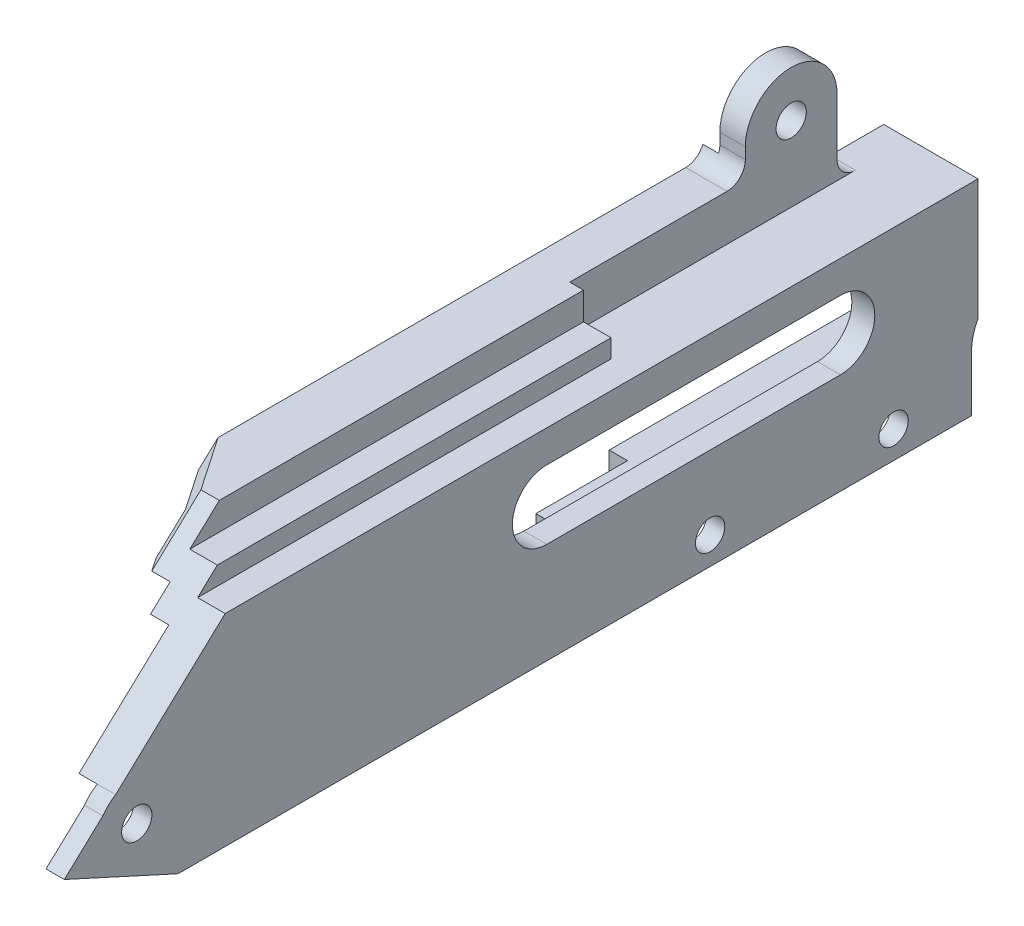
from build123d import *
from build123d.topology import SkipClean

# Parameters (mm, degrees)
SKETCH_1_W                       = 33.2
SKETCH_1_H                       = 22
SKETCH_1_R                       = 1.6
EXTRUDE_1_DEPTH                  = 7
SKETCH_2_W                       = 33.2
SKETCH_2_H                       = 10.5
EXTRUDE_2_DEPTH                  = 2
EXTRUDE_3_DEPTH                  = 60
SKETCH_4_W                       = 2
SKETCH_4_H                       = 10.5
EXTRUDE_4_DEPTH                  = 38.5
SKETCH_5_W                       = 4
SKETCH_5_H                       = 10.5
EXTRUDE_5_DEPTH                  = 2
SKETCH_6_W                       = 4
SKETCH_6_H                       = 10.5
EXTRUDE_6_DEPTH                  = 19.5
SKETCH_7_W                       = 6
SKETCH_7_H                       = 93.2
EXTRUDE_7_DEPTH                  = 2
SKETCH_8_W                       = 93.2
SKETCH_8_H                       = 5
EXTRUDE_8_DEPTH                  = 3
SKETCH_10_W                      = 93.2
SKETCH_10_H                      = 2
EXTRUDE_9_DEPTH                  = 5.5
SKETCH_12_W                      = 18
SKETCH_12_H                      = 2
CUT_EXTRUDE_1_DEPTH              = 5.5
SKETCH_13_W                      = 40
SKETCH_13_H                      = 5
EXTRUDE_10_DEPTH                 = 3.5
CUT_EXTRUDE_2_REACH              = 70.879
SKETCH_15_W                      = 15.5
SKETCH_15_H                      = 5
SKETCH_16_W                      = 3.5
SKETCH_16_H                      = 2.5
EXTRUDE_12_DEPTH                 = 2
CUT_EXTRUDE_3_REACH              = 71.313
CHAMFER_1_SIZE                   = 3.5
SKETCH_18_R                      = 1.65
EXTRUDE_13_DEPTH                 = 2
FILLET_1_R                       = 2
SKETCH_19_W                      = 4.5
SKETCH_19_H                      = 21.5
CUT_EXTRUDE_4_DEPTH              = 5
CHAMFER_2_SIZE                   = 3
CUT_EXTRUDE_5_REACH              = 74.561
SKETCH_20_R                      = 1.65
EXTRUDE_14_REACH                 = 73.895
SKETCH_21_R                      = 4.5
SKETCH_21_R_2                    = 1.65
EXTRUDE_15_DEPTH                 = 6
EXTRUDE_16_DEPTH                 = 4
CUT_EXTRUDE_6_REACH              = 83.84
SKETCH_24_R                      = 1.65
CUT_EXTRUDE_7_REACH              = 84.171
SKETCH_26_W                      = 2
SKETCH_26_H                      = 10.5
CUT_EXTRUDE_8_DEPTH              = 5
SKETCH_27_W                      = 2
SKETCH_27_H                      = 2
EXTRUDE_17_DEPTH                 = 10
CUT_EXTRUDE_9_DEPTH              = 2
CUT_EXTRUDE_10_REACH             = 84.426
SKETCH_29_R                      = 5.5
SKETCH_30_W                      = 63
SKETCH_30_H                      = 2
EXTRUDE_18_DEPTH                 = 1
SKETCH_32_R                      = 1.65
EXTRUDE_19_DEPTH                 = 0.775
EXTRUDE_20_DEPTH                 = 5.5
SKETCH_35_W                      = 5
SKETCH_35_H                      = 10
CUT_EXTRUDE_12_DEPTH             = 1.225
SKETCH_36_W                      = 4
SKETCH_36_H                      = 10
EXTRUDE_21_DEPTH                 = 5
CUT_EXTRUDE_13_REACH             = 84.197
SKETCH_37_W                      = 4.75
SKETCH_37_H                      = 3
CUT_EXTRUDE_13_DIRECTION_2_REACH = 84.197
CUT_EXTRUDE_14_REACH             = 84.197
SKETCH_38_W                      = 14.6
SKETCH_38_H                      = 11
CUT_EXTRUDE_14_DIRECTION_2_DEPTH = 1
SKETCH_39_W                      = 1.5
SKETCH_39_H                      = 20
EXTRUDE_22_DEPTH                 = 5.8
EXTRUDE_22_DIRECTION_2_REACH     = 116.063
SKETCH_40_W                      = 1.5
SKETCH_40_H                      = 10
EXTRUDE_23_DEPTH                 = 5
CUT_EXTRUDE_15_REACH             = 84.085
SKETCH_41_W                      = 1
SKETCH_41_H                      = 7
CHAMFER_3_SIZE                   = 1
SKETCH_42_W                      = 2.775
SKETCH_42_H                      = 5
EXTRUDE_24_DEPTH                 = 10.8
CUT_EXTRUDE_16_REACH             = 84.085
SKETCH_43_W                      = 0.6
SKETCH_43_H                      = 2
SKETCH_44_W                      = 9.8
SKETCH_44_H                      = 2
EXTRUDE_25_DEPTH                 = 2
SKETCH_45_W                      = 0.8
SKETCH_45_H                      = 6.1
CUT_EXTRUDE_17_DEPTH             = 0.775
CUT_EXTRUDE_18_REACH             = 84.426
SKETCH_46_R                      = 2.05
CUT_EXTRUDE_19_DEPTH             = 1
SKETCH_48_R                      = 2.05
CUT_EXTRUDE_20_DEPTH             = 5
CUT_EXTRUDE_21_REACH             = 113.959
SKETCH_50_W                      = 0.5
SKETCH_50_H                      = 17.5
CUT_EXTRUDE_22_DEPTH             = 3
EXTRUDE_26_DEPTH                 = 14.5
EXTRUDE_27_DEPTH                 = 0.5
SKETCH_54_W                      = 28.68337521
SKETCH_54_H                      = 12.5
SKETCH_54_W_2                    = 11.341687605
CUT_EXTRUDE_23_DEPTH             = 3
EXTRUDE_28_REACH                 = 83.879
FILLET_2_R                       = 0.8
EXTRUDE_START                    = -3.5
SKETCH_56_R                      = 4
SKETCH_56_R_2                    = 2.05
EXTRUDE_29_DEPTH                 = 3.5
FILLET_3_R                       = 0.8
CUT_EXTRUDE_24_REACH             = 83.879
SKETCH_57_R                      = 2.05
SKETCH_58_W                      = 15.2
SKETCH_58_H                      = 8.5
CUT_EXTRUDE_25_DEPTH             = 3.5
FILLET_4_R                       = 0.8
EXTRUDE_START_2                  = 0.5
SKETCH_31_W                      = 76.7
SKETCH_31_H                      = 10.5
EXTRUDE_30_DEPTH                 = 0.5
CUT_EXTRUDE_26_REACH             = 83.939
SKETCH_59_W                      = 2.6
SKETCH_59_H                      = 10
CUT_EXTRUDE_27_REACH             = 83.939
EXTRUDE_31_DEPTH                 = 1.5
SKETCH_62_W                      = 2.775
SKETCH_62_H                      = 2
EXTRUDE_32_DEPTH                 = 1.5
EXTRUDE_33_DEPTH                 = 1.5
SKETCH_64_W                      = 4.275
SKETCH_64_H                      = 5
EXTRUDE_34_DEPTH                 = 5
CHAMFER_4_SIZE                   = 2
EXTRUDE_START_3                  = 1.5
SKETCH_65_R                      = 2.05
EXTRUDE_35_DEPTH                 = 1.5
CUT_EXTRUDE_28_DEPTH             = 1
SKETCH_67_W                      = 1.5
SKETCH_67_H                      = 1.5
EXTRUDE_36_DEPTH                 = 1.5
CUT_EXTRUDE_29_REACH             = 76.844
EXTRUDE_37_REACH                 = 74.163
CUT_EXTRUDE_30_DEPTH             = 10
EXTRUDE_38_DEPTH                 = 0.5
CUT_EXTRUDE_START                = -36.378813151
CUT_EXTRUDE_31_OUTLINE_W         = 3
CUT_EXTRUDE_31_OUTLINE_H         = 6
CUT_EXTRUDE_31_DEPTH             = 0.35355339
FILLET_5_R                       = 1
CUT_EXTRUDE_32_DEPTH             = 101
CUT_EXTRUDE_34_REACH             = 83.84
CUT_EXTRUDE_34_DIRECTION_2_REACH = 83.84
EXTRUDE_START_4                  = 1.225
SKETCH_76_R                      = 1.6
EXTRUDE_40_DEPTH                 = 1.225
CUT_EXTRUDE_35_DEPTH             = 4
CUT_EXTRUDE_36_REACH             = 79.818
FILLET_7_R                       = 1
FILLET_8_R                       = 2.5


# Read off the part's stored shape, not the designer's step: 切除-拉伸31
# Some blends are built 0.0001 mm under size
with BuildPart() as part:
    # 草图1 → 凸台-拉伸1 (new body)
    with BuildSketch(Plane(origin=(0, 0, 0), x_dir=(0, 0, -1), z_dir=(1, 0, 0))):
        with Locations((12.6, -4.5)):
            Rectangle(SKETCH_1_W, SKETCH_1_H)
        Circle(SKETCH_1_R, mode=Mode.SUBTRACT)
        with Locations((20, 0)):
            Circle(SKETCH_1_R, mode=Mode.SUBTRACT)
    extrude(amount=EXTRUDE_1_DEPTH)

    # 草图2 → 凸台-拉伸2 (add)
    with BuildSketch(Plane(origin=(7, 0, 0), x_dir=(0, 0, -1), z_dir=(1, 0, 0))):
        with Locations((12.6, 11.75)):
            Rectangle(SKETCH_2_W, SKETCH_2_H)
    extrude(amount=-EXTRUDE_2_DEPTH)

    # 草图3 → 凸台-拉伸3 (add)
    with BuildSketch(Plane.XY.offset(4)):
        Polygon((7, -15.5), (1, -15.5), (1, 4.5), (3, 4.5), (3, 6.5), (7, 6.5), align=None)
    extrude(amount=EXTRUDE_3_DEPTH)

    # 草图4 → 凸台-拉伸4 (add)
    with BuildSketch(Plane.XY.offset(4)):
        with Locations((6, 11.75)):
            Rectangle(SKETCH_4_W, SKETCH_4_H)
    extrude(amount=EXTRUDE_4_DEPTH)

    # 草图5 → 凸台-拉伸5 (add)
    with BuildSketch(Plane.XY.offset(42.5)):
        with Locations((5, 11.75)):
            Rectangle(SKETCH_5_W, SKETCH_5_H)
    extrude(amount=EXTRUDE_5_DEPTH)

    # 草图6 → 凸台-拉伸6 (add)
    with BuildSketch(Plane.XY.offset(44.5)):
        with Locations((5, 11.75)):
            Rectangle(SKETCH_6_W, SKETCH_6_H)
    extrude(amount=EXTRUDE_6_DEPTH)

    # 草图7 → 凸台-拉伸7 (add)
    with BuildSketch(Plane(origin=(0, 17, 0), x_dir=(1, 0, 0), z_dir=(0, 1, 0))):
        with Locations((4, -17.4)):
            Rectangle(SKETCH_7_W, SKETCH_7_H)
    extrude(amount=EXTRUDE_7_DEPTH)

    # 草图8 → 凸台-拉伸8 (add)
    with BuildSketch(Plane.ZY.offset(-1)):
        with Locations((17.4, 21.5)):
            Rectangle(SKETCH_8_W, SKETCH_8_H)
    extrude(amount=-EXTRUDE_8_DEPTH)

    # 草图10 → 凸台-拉伸9 (add)
    with BuildSketch(Plane.ZY.offset(-1)):
        with Locations((17.4, 23)):
            Rectangle(SKETCH_10_W, SKETCH_10_H)
    extrude(amount=EXTRUDE_9_DEPTH)

    # 草图12 → 切除-拉伸1 (cut)
    with BuildSketch(Plane.ZY.offset(4.5)):
        with Locations((-20.2, 23)):
            Rectangle(SKETCH_12_W, SKETCH_12_H)
    extrude(amount=-CUT_EXTRUDE_1_DEPTH, mode=Mode.SUBTRACT)

    # 草图13 → 凸台-拉伸10 (add)
    with BuildSketch(Plane.ZY.offset(-1)):
        with Locations((-9.2, 19.5)):
            Rectangle(SKETCH_13_W, SKETCH_13_H)
    extrude(amount=EXTRUDE_10_DEPTH)

    # 草图15 → 切除-拉伸2 (cut, up to next)
    with BuildSketch(Plane(origin=(4, 0, 0), x_dir=(0, 0, -1), z_dir=(1, 0, 0)), mode=Mode.PRIVATE) as cut_extrude_2_sk1:
        with Locations((21.45, 21.5)):
            Rectangle(SKETCH_15_W, SKETCH_15_H)
    cut_extrude_2_tool1 = extrude(cut_extrude_2_sk1.sketch, amount=-CUT_EXTRUDE_2_REACH, mode=Mode.PRIVATE) & part.part
    add(cut_extrude_2_tool1.solids().sort_by_distance((4, 21.5, -21.45))[0], mode=Mode.SUBTRACT)

    # 草图16 → 凸台-拉伸12 (add)
    with BuildSketch(Plane(origin=(0, 22, 0), x_dir=(1, 0, 0), z_dir=(0, 1, 0))):
        with Locations((-0.75, 12.45)):
            Rectangle(SKETCH_16_W, SKETCH_16_H)
    extrude(amount=EXTRUDE_12_DEPTH)

    # 草图17 → 切除-拉伸3 (cut, up to next)
    with BuildSketch(Plane(origin=(7, 0, 0), x_dir=(0, 0, -1), z_dir=(1, 0, 0)), mode=Mode.PRIVATE) as cut_extrude_3_sk1:
        Polygon((-47.5, 24), (-64, 8.613501079), (-64, 24), align=None)
    cut_extrude_3_tool1 = extrude(cut_extrude_3_sk1.sketch, amount=-CUT_EXTRUDE_3_REACH, mode=Mode.PRIVATE) & part.part
    add(cut_extrude_3_tool1.solids().sort_by_distance((7, 18.871167, 58.5))[0], mode=Mode.SUBTRACT)

    # 倒角1
    # the kernel refuses this chamfer: 3.5 mm, written as the material it takes off along each edge
    with BuildSketch(Plane(origin=(-4.5, 15.861407469, 56.227571974), x_dir=(0.9996219169112969, 0.020109211138415985, 0.018752142756900524), z_dir=(0, 0.6819983600625026, -0.7313537016191667))) as chamfer_1_piece_1:
        Polygon((CHAMFER_1_SIZE * 0.999621916911, CHAMFER_1_SIZE * 0.0274958766106), (-CHAMFER_1_SIZE * 0.0274958766106, CHAMFER_1_SIZE * 0.999621916911), (0, 0), align=None)
    extrude(amount=20.934339287, mode=Mode.SUBTRACT)

    # 草图18 → 凸台-拉伸13 (add)
    with BuildSketch(Plane.ZY.offset(2.5)):
        with BuildLine():
            Line((-11.337, 27.2), (-11.337, 24))
            Line((-11.337, 24), (-13.7, 24))
            Line((-13.7, 24), (-13.7, 19))
            Line((-13.7, 19), (-21.337, 19))
            Line((-21.337, 19), (-21.337, 27.2))
            ThreePointArc((-21.337, 27.2), (-16.337, 32.2), (-11.337, 27.2))
        make_face()
        with Locations((-16.337, 27.2)):
            Circle(SKETCH_18_R, mode=Mode.SUBTRACT)
    extrude(amount=-EXTRUDE_13_DEPTH)

    # 圆角1
    fillet_1_edges = [part.edges().sort_by_distance(p)[0] for p in [
        (-1.5, 24, -11.337),
        (-1.5, 19, -21.337),
    ]]
    fillet(fillet_1_edges, radius=FILLET_1_R)

    # 草图19 → 切除-拉伸4 (cut)
    with BuildSketch(Plane(origin=(0, 24, 0), x_dir=(1, 0, 0), z_dir=(0, 1, 0))):
        with Locations((1.75, 2.95)):
            Rectangle(SKETCH_19_W, SKETCH_19_H)
    extrude(amount=-CUT_EXTRUDE_4_DEPTH, mode=Mode.SUBTRACT)

    # 倒角2
    chamfer_2_edges = [part.edges().sort_by_distance(p)[0] for p in [
        (4, 24, 27.65),
        (1, 22, 30.22236871),
    ]]
    chamfer(chamfer_2_edges, length=CHAMFER_2_SIZE)

    # 草图20 → 切除-拉伸5 (cut, up to next)
    with BuildSketch(Plane(origin=(7, 0, 0), x_dir=(0, 0, -1), z_dir=(1, 0, 0)), mode=Mode.PRIVATE) as cut_extrude_5_sk1:
        with Locations((-62.5, 4)):
            Circle(SKETCH_20_R)
    cut_extrude_5_tool1 = extrude(cut_extrude_5_sk1.sketch, amount=-CUT_EXTRUDE_5_REACH, mode=Mode.PRIVATE) & part.part
    add(cut_extrude_5_tool1.solids().sort_by_distance((7, 4, 62.5))[0], mode=Mode.SUBTRACT)

    # 凸台-拉伸14: up to this face of the body (flat: up to its plane)
    extrude_14_end = Plane(part.part.faces().sort_by_distance((7, 1.498387626, 16.627822956))[0])
    # 草图21 → 凸台-拉伸14 (add, up to the picked face)
    with BuildSketch(Plane.ZY.offset(-1), mode=Mode.PRIVATE) as extrude_14_sk1:
        with Locations((62.5, 4)):
            Circle(SKETCH_21_R)
        with Locations(Location((62.5, 4, 0), (0, 0, 180))):
            Circle(SKETCH_21_R_2, mode=Mode.SUBTRACT)
    extrude_14_tool1 = split(extrude(extrude_14_sk1.sketch, amount=-EXTRUDE_14_REACH, mode=Mode.PRIVATE), bisect_by=extrude_14_end, keep=Keep.BOTH, mode=Mode.PRIVATE)
    add(extrude_14_tool1.solids().sort_by(Axis((1, 4, 58.127279), (1, 0, 0)))[0])

    # 草图22 → 凸台-拉伸15 (add)
    with BuildSketch(Plane.ZY.offset(-1)):
        with BuildLine():
            Line((66.198595209, 6.563277878), (75, -1.644164869))
            Line((75, -1.644164869), (75, -15.5))
            Line((75, -15.5), (64, -15.5))
            Line((64, -15.5), (64, -0.242640687))
            ThreePointArc((64, -0.242640687), (66.782111619, 2.616699568), (66.198595209, 6.563277878))
        make_face()
    extrude(amount=-EXTRUDE_15_DEPTH)

    # 草图23 → 凸台-拉伸16 (add)
    with BuildSketch(Plane(origin=(7, 0, 0), x_dir=(0, 0, -1), z_dir=(1, 0, 0))):
        Polygon((-64, 8.613501079), (-64.799032902, 7.868390843), (-64, 8.242640687), align=None)
    extrude(amount=-EXTRUDE_16_DEPTH)

    # 草图24 → 切除-拉伸6 (cut, up to next)
    with BuildSketch(Plane.ZY.offset(-1), mode=Mode.PRIVATE) as cut_extrude_6_sk1:
        with Locations(Location((71, -10.5, 0), (0, 0, 270))):
            Circle(SKETCH_24_R)
    cut_extrude_6_tool1 = extrude(cut_extrude_6_sk1.sketch, amount=-CUT_EXTRUDE_6_REACH, mode=Mode.PRIVATE) & part.part
    add(cut_extrude_6_tool1.solids().sort_by_distance((1, -10.5, 71))[0], mode=Mode.SUBTRACT)

    # 草图25 → 切除-拉伸7 (cut, up to next)
    with BuildSketch(Plane.ZY.offset(-5), mode=Mode.PRIVATE) as cut_extrude_7_sk1:
        with BuildLine():
            Line((17.8, 8), (-14.2, 8))
            ThreePointArc((-14.2, 8), (-17.95, 11.75), (-14.2, 15.5))
            Line((-14.2, 15.5), (17.8, 15.5))
            ThreePointArc((17.8, 15.5), (21.55, 11.75), (17.8, 8))
        make_face()
    cut_extrude_7_tool1 = extrude(cut_extrude_7_sk1.sketch, amount=-CUT_EXTRUDE_7_REACH, mode=Mode.PRIVATE) & part.part
    add(cut_extrude_7_tool1.solids().sort_by_distance((5, 11.75, 1.8))[0], mode=Mode.SUBTRACT)

    # 草图26 → 切除-拉伸8 (cut)
    with BuildSketch(Plane(origin=(0, 0, 42.5), x_dir=(-1, 0, 0), z_dir=(0, 0, -1))):
        with Locations((-4, 11.75)):
            Rectangle(SKETCH_26_W, SKETCH_26_H)
    extrude(amount=-CUT_EXTRUDE_8_DEPTH, mode=Mode.SUBTRACT)

    # 草图27 → 凸台-拉伸17 (add)
    with BuildSketch(Plane.XY.offset(4)):
        with Locations((2, 5.5)):
            Rectangle(SKETCH_27_W, SKETCH_27_H)
    extrude(amount=EXTRUDE_17_DEPTH)

    # 草图28 → 切除-拉伸9 (cut)
    with BuildSketch(Plane.ZY.offset(-1)):
        Polygon((67, 1.494263267), (67, -15.5), (75, -15.5), (75, -1.644164869), (69.155582564, 3.80584256), align=None)
    extrude(amount=-CUT_EXTRUDE_9_DEPTH, mode=Mode.SUBTRACT)

    # 草图29 → 切除-拉伸10 (cut, up to next)
    with BuildSketch(Plane(origin=(7, 0, 0), x_dir=(0, 0, -1), z_dir=(1, 0, 0)), mode=Mode.PRIVATE) as cut_extrude_10_sk1:
        with Locations((34, 3.1)):
            Circle(SKETCH_29_R)
    cut_extrude_10_tool1 = extrude(cut_extrude_10_sk1.sketch, amount=-CUT_EXTRUDE_10_REACH, mode=Mode.PRIVATE) & part.part
    add(cut_extrude_10_tool1.solids().sort_by_distance((7, 3.1, -34))[0], mode=Mode.SUBTRACT)

    # 草图30 → 凸台-拉伸18 (add)
    with BuildSketch(Plane.ZY.offset(-1)):
        with Locations((35.5, -5.5)):
            Rectangle(SKETCH_30_W, SKETCH_30_H)
    extrude(amount=EXTRUDE_18_DEPTH)

    # 草图32 → 凸台-拉伸19 (add)
    with BuildSketch(Plane.ZY.offset(2.5)):
        with BuildLine():
            Line((-11.2, 22), (-11.2, 25.272517354))
            ThreePointArc((-11.2, 25.272517354), (-11.302451602, 25.62986489), (-11.337, 26))
            Line((-11.337, 26), (-11.337, 27.2))
            ThreePointArc((-11.337, 27.2), (-16.337, 32.2), (-21.337, 27.2))
            Line((-21.337, 27.2), (-21.337, 21))
            ThreePointArc((-21.337, 21), (-21.922786438, 19.585786438), (-23.337, 19))
            Line((-23.337, 19), (-29.2, 19))
            Line((-29.2, 19), (-29.2, 17))
            Line((-29.2, 17), (10.8, 17))
            Line((10.8, 17), (10.8, 22))
            Line((10.8, 22), (-11.2, 22))
        make_face()
        with Locations((-16.337, 27.2)):
            Circle(SKETCH_32_R, mode=Mode.SUBTRACT)
    extrude(amount=EXTRUDE_19_DEPTH)

    # 草图34 → 凸台-拉伸20 (add)
    with BuildSketch(Plane.XZ.offset(15.5)):
        Polygon((3, 75), (3, 67), (1, 67), (1, 4), (0, 4), (0, -29.2), (7, -29.2), (7, 75), align=None)
    extrude(amount=EXTRUDE_20_DEPTH)

    # 草图35 → 切除-拉伸12 (cut)
    with BuildSketch(Plane.ZY):
        with Locations((-26.7, -16)):
            Rectangle(SKETCH_35_W, SKETCH_35_H)
    extrude(amount=-CUT_EXTRUDE_12_DEPTH, mode=Mode.SUBTRACT)

    # 草图36 → 凸台-拉伸21 (add)
    with BuildSketch(Plane(origin=(0, 0, -29.2), x_dir=(-1, 0, 0), z_dir=(0, 0, -1))):
        with Locations((-3.225, -16)):
            Rectangle(SKETCH_36_W, SKETCH_36_H)
    extrude(amount=EXTRUDE_21_DEPTH)

    # 草图37 → 切除-拉伸13 (cut, up to next)
    with BuildSketch(Plane(origin=(5.225, 0, 0), x_dir=(0, 0, -1), z_dir=(1, 0, 0)), mode=Mode.PRIVATE) as cut_extrude_13_sk1:
        with Locations((31.225, -14.5)):
            Rectangle(SKETCH_37_W, SKETCH_37_H)
    cut_extrude_13_tool1 = extrude(cut_extrude_13_sk1.sketch, amount=-CUT_EXTRUDE_13_REACH, mode=Mode.PRIVATE) & part.part
    add(cut_extrude_13_tool1.solids().sort_by_distance((5.225, -14.5, -31.225))[0], mode=Mode.SUBTRACT)

    # 草图37 → 切除-拉伸13 direction 2 (cut, up to next)
    with BuildSketch(Plane(origin=(5.225, 0, 0), x_dir=(0, 0, -1), z_dir=(1, 0, 0)), mode=Mode.PRIVATE) as cut_extrude_13_direction_2_sk1:
        with Locations((31.225, -14.5)):
            Rectangle(SKETCH_37_W, SKETCH_37_H)
    cut_extrude_13_direction_2_tool1 = extrude(cut_extrude_13_direction_2_sk1.sketch, amount=CUT_EXTRUDE_13_DIRECTION_2_REACH, mode=Mode.PRIVATE) & part.part
    add(cut_extrude_13_direction_2_tool1.solids().sort_by_distance((5.225, -14.5, -31.225))[0], mode=Mode.SUBTRACT)

    # 草图38 → 切除-拉伸14 (cut, up to next)
    with BuildSketch(Plane(origin=(5.225, 0, 0), x_dir=(0, 0, -1), z_dir=(1, 0, 0)), mode=Mode.PRIVATE) as cut_extrude_14_sk1:
        with Locations((26.9, -8.5)):
            Rectangle(SKETCH_38_W, SKETCH_38_H)
    cut_extrude_14_tool1 = extrude(cut_extrude_14_sk1.sketch, amount=CUT_EXTRUDE_14_REACH, mode=Mode.PRIVATE) & part.part
    add(cut_extrude_14_tool1.solids().sort_by_distance((5.225, -8.5, -26.9))[0], mode=Mode.SUBTRACT)

    # 草图38 → 切除-拉伸14 direction 2 (cut)
    with BuildSketch(Plane(origin=(5.225, 0, 0), x_dir=(0, 0, -1), z_dir=(1, 0, 0))):
        with Locations((26.9, -8.5)):
            Rectangle(SKETCH_38_W, SKETCH_38_H)
    extrude(amount=-CUT_EXTRUDE_14_DIRECTION_2_DEPTH, mode=Mode.SUBTRACT)

    # 草图39 → 凸台-拉伸22 (add)
    with BuildSketch(Plane(origin=(0, 0, -34.2), x_dir=(-1, 0, 0), z_dir=(0, 0, -1))):
        with Locations((-3.475, -11)):
            Rectangle(SKETCH_39_W, SKETCH_39_H)
    extrude(amount=EXTRUDE_22_DEPTH)

    # 草图39 → 凸台-拉伸22 direction 2 (add, up to next)
    with BuildSketch(Plane(origin=(0, 0, -34.2), x_dir=(-1, 0, 0), z_dir=(0, 0, -1)), mode=Mode.PRIVATE) as extrude_22_direction_2_sk1:
        with Locations((-3.475, -11)):
            Rectangle(SKETCH_39_W, SKETCH_39_H)
    extrude_22_direction_2_tool1 = extrude(extrude_22_direction_2_sk1.sketch, amount=-EXTRUDE_22_DIRECTION_2_REACH, mode=Mode.PRIVATE) - part.part
    add(extrude_22_direction_2_tool1.solids().sort_by_distance((3.475, -11, -34.2))[0])

    # 草图40 → 凸台-拉伸23 (add)
    with BuildSketch(Plane(origin=(0, 0, -29.2), x_dir=(-1, 0, 0), z_dir=(0, 0, -1))):
        with Locations((-1.975, -6)):
            Rectangle(SKETCH_40_W, SKETCH_40_H)
    extrude(amount=EXTRUDE_23_DEPTH)

    # 草图41 → 切除-拉伸15 (cut, up to next)
    with BuildSketch(Plane(origin=(4.225, 0, 0), x_dir=(0, 0, -1), z_dir=(1, 0, 0)), mode=Mode.PRIVATE) as cut_extrude_15_sk1:
        with Locations((39.5, -4.5)):
            Rectangle(SKETCH_41_W, SKETCH_41_H)
    cut_extrude_15_tool1 = extrude(cut_extrude_15_sk1.sketch, amount=-CUT_EXTRUDE_15_REACH, mode=Mode.PRIVATE) & part.part
    add(cut_extrude_15_tool1.solids().sort_by_distance((4.225, -4.5, -39.5))[0], mode=Mode.SUBTRACT)

    # 倒角3
    chamfer_3_edges = [part.edges().sort_by_distance(p)[0] for p in [
        (3.475, -8, -39),
    ]]
    chamfer(chamfer_3_edges, length=CHAMFER_3_SIZE - 0.0001)  # a hair under: the kernel refuses the full size

    # 草图42 → 凸台-拉伸24 (add)
    with BuildSketch(Plane(origin=(0, 0, -29.2), x_dir=(-1, 0, 0), z_dir=(0, 0, -1))):
        with Locations((-5.6125, -18.5)):
            Rectangle(SKETCH_42_W, SKETCH_42_H)
    extrude(amount=EXTRUDE_24_DEPTH)

    # 草图43 → 切除-拉伸16 (cut, up to next)
    with BuildSketch(Plane(origin=(4.225, 0, 0), x_dir=(0, 0, -1), z_dir=(1, 0, 0)), mode=Mode.PRIVATE) as cut_extrude_16_sk1:
        with Locations((33.9, -15)):
            Rectangle(SKETCH_43_W, SKETCH_43_H)
    cut_extrude_16_tool1 = extrude(cut_extrude_16_sk1.sketch, amount=CUT_EXTRUDE_16_REACH, mode=Mode.PRIVATE) & part.part
    add(cut_extrude_16_tool1.solids().sort_by_distance((4.225, -15, -33.9))[0], mode=Mode.SUBTRACT)

    # 草图44 → 凸台-拉伸25 (add)
    with BuildSketch(Plane(origin=(4.225, 0, 0), x_dir=(0, 0, -1), z_dir=(1, 0, 0))):
        with Locations((34.1, -2)):
            Rectangle(SKETCH_44_W, SKETCH_44_H)
    extrude(amount=EXTRUDE_25_DEPTH)

    # 草图45 → 切除-拉伸17 (cut)
    with BuildSketch(Plane(origin=(7, 0, 0), x_dir=(0, 0, -1), z_dir=(1, 0, 0))):
        with Locations((28.9, 0.05)):
            Rectangle(SKETCH_45_W, SKETCH_45_H)
    extrude(amount=-CUT_EXTRUDE_17_DEPTH, mode=Mode.SUBTRACT)

    # 草图46 → 切除-拉伸18 (cut, up to next)
    with BuildSketch(Plane(origin=(7, 0, 0), x_dir=(0, 0, -1), z_dir=(1, 0, 0)), mode=Mode.PRIVATE) as cut_extrude_18_sk1:
        with Locations((13.25, -17)):
            Circle(SKETCH_46_R)
    cut_extrude_18_tool1 = extrude(cut_extrude_18_sk1.sketch, amount=-CUT_EXTRUDE_18_REACH, mode=Mode.PRIVATE) & part.part
    add(cut_extrude_18_tool1.solids().sort_by_distance((7, -17, -13.25))[0], mode=Mode.SUBTRACT)

    # 草图47 → 切除-拉伸19 (cut)
    with BuildSketch(Plane.ZY.offset(-1)):
        with BuildLine():
            Line((62.5, -0.5), (67, -0.5))
            Line((67, -0.5), (67, -4.5))
            Line((67, -4.5), (4, -4.5))
            Line((4, -4.5), (4, 6.5))
            Line((4, 6.5), (14, 6.5))
            Line((14, 6.5), (14, 4.5))
            Line((14, 4.5), (58.027864045, 4.5))
            ThreePointArc((58.027864045, 4.5), (59.145898034, 1), (62.5, -0.5))
        make_face()
    extrude(amount=-CUT_EXTRUDE_19_DEPTH, mode=Mode.SUBTRACT)

    # 草图48 → 切除-拉伸20 (cut)
    with BuildSketch(Plane.XZ.offset(21)):
        with Locations(Location((3.5, 58, 0), (0, 0, 270))):
            Circle(SKETCH_48_R)
        with Locations(Location((3.5, 20, 0), (0, 0, 270))):
            Circle(SKETCH_48_R)
        with Locations(Location((3.5, -18, 0), (0, 0, 270))):
            Circle(SKETCH_48_R)
    extrude(amount=-CUT_EXTRUDE_20_DEPTH, mode=Mode.SUBTRACT)

    # 草图50 → 切除-拉伸21 (cut, up to next)
    with BuildSketch(Plane.XY.offset(67), mode=Mode.PRIVATE) as cut_extrude_21_sk1:
        with Locations((0.25, -12.25)):
            Rectangle(SKETCH_50_W, SKETCH_50_H)
    cut_extrude_21_tool1 = extrude(cut_extrude_21_sk1.sketch, amount=-CUT_EXTRUDE_21_REACH, mode=Mode.PRIVATE) & part.part
    add(cut_extrude_21_tool1.solids().sort_by_distance((0.25, -12.25, 67))[0], mode=Mode.SUBTRACT)

    # 草图51 → 切除-拉伸22 (cut)
    with BuildSketch(Plane(origin=(0, 0, -28.85), x_dir=(-1, 0, 0), z_dir=(0, 0, -1))):
        Polygon((-4.225, -14), (-7, -14), (-7, -16), (-1.225, -16), (-1.225, -13), (-4.225, -13), align=None)
    extrude(amount=-CUT_EXTRUDE_22_DEPTH, mode=Mode.SUBTRACT)

    # 草图52 → 凸台-拉伸26 (add)
    with BuildSketch(Plane.XZ.offset(21)):
        with BuildLine():
            Line((1, 59.658312395), (1, 56.341687605))
            ThreePointArc((1, 56.341687605), (0.5, 58), (1, 59.658312395))
        make_face()
        with BuildLine():
            Line((1, 21.658312395), (1, 18.341687605))
            ThreePointArc((1, 18.341687605), (0.5, 20), (1, 21.658312395))
        make_face()
    extrude(amount=-EXTRUDE_26_DEPTH)

    # 草图53 → 凸台-拉伸27 (add)
    with BuildSketch(Plane.ZY.offset(-1)):
        Polygon((4, -21), (4, -19), (18.341687605, -19), (18.341687605, -6.5), (21.658312395, -6.5), (21.658312395, -19), (56.341687605, -19), (56.341687605, -6.5), (59.658312395, -6.5), (59.658312395, -19), (66, -19), (66, -6.5), (67, -6.5), (67, -19), (67, -21), align=None)
    extrude(amount=EXTRUDE_27_DEPTH)

    # 草图54 → 切除-拉伸23 (cut)
    with BuildSketch(Plane.ZY.offset(-1)):
        with Locations((39, -12.75)):
            Rectangle(SKETCH_54_W, SKETCH_54_H)
        with Locations((9.670843803, -12.75)):
            Rectangle(SKETCH_54_W_2, SKETCH_54_H)
    extrude(amount=-CUT_EXTRUDE_23_DEPTH, mode=Mode.SUBTRACT)

    # 草图55 → 凸台-拉伸28 (add, up to next)
    with BuildSketch(Plane.ZY.offset(-0.5), mode=Mode.PRIVATE) as extrude_28_sk1:
        Polygon((4, -18.336739034), (17.580705079, -6.5), (18.341687605, -6.5), (18.341687605, -7.163260966), (4.760982526, -19), (4, -19), align=None)
    extrude_28_tool1 = extrude(extrude_28_sk1.sketch, amount=-EXTRUDE_28_REACH, mode=Mode.PRIVATE) - part.part
    # 草图55 → 凸台-拉伸28 (add, up to next)
    with BuildSketch(Plane.ZY.offset(-0.5), mode=Mode.PRIVATE) as extrude_28_sk2:
        Polygon((23.132998269, -6.5), (39, -12.218518467), (54.867001731, -6.5), (56.341687605, -6.5), (56.341687605, -7.031481533), (40.474685873, -12.75), (56.341687605, -18.468518467), (56.341687605, -19), (54.867001731, -19), (39, -13.281481533), (23.132998269, -19), (21.658312395, -19), (21.658312395, -18.468518467), (37.525314127, -12.75), (21.658312395, -7.031481533), (21.658312395, -6.5), align=None)
    extrude_28_tool2 = extrude(extrude_28_sk2.sketch, amount=-EXTRUDE_28_REACH, mode=Mode.PRIVATE) - part.part
    # 草图55 → 凸台-拉伸28 (add, up to next)
    with BuildSketch(Plane.ZY.offset(-0.5), mode=Mode.PRIVATE) as extrude_28_sk3:
        Polygon((59.658312395, -7.605121348), (65.439333252, -19), (66, -19), (66, -17.894878652), (60.218979144, -6.5), (59.658312395, -6.5), align=None)
    extrude_28_tool3 = extrude(extrude_28_sk3.sketch, amount=-EXTRUDE_28_REACH, mode=Mode.PRIVATE) - part.part
    add(extrude_28_tool1.solids().sort_by_distance((0.5, -12.75, 11.170844))[0])
    add(extrude_28_tool2.solids().sort_by_distance((0.5, -12.75, 39))[0])
    add(extrude_28_tool3.solids().sort_by_distance((0.5, -12.75, 62.829156))[0])

    # 圆角2
    fillet_2_edges = [part.edges().sort_by_distance(p)[0] for p in [
        (2.25, -19, 4.760982526),
        (2.25, -18.336739034, 4),
        (2.5, -8.451494077, 15.341687605),
        (2.5, -9.77801601, 15.341687605),
        (0.75, -7.163260966, 18.341687605),
        (0.75, -6.5, 17.580705079),
        (0.75, -6.5, 54.867001731),
        (0.75, -6.5, 23.132998269),
        (2.25, -12.218518467, 39),
        (2.5, -8.112691184, 53.341687605),
        (0.75, -7.031481533, 56.341687605),
        (2.5, -17.387308816, 53.341687605),
        (2.25, -12.75, 40.474685873),
        (0.75, -19, 54.867001731),
        (2.25, -13.281481533, 39),
        (0.75, -18.468518467, 21.658312395),
        (2.25, -12.75, 37.525314127),
        (0.75, -7.031481533, 21.658312395),
        (0.75, -19, 23.132998269),
        (0.75, -18.468518467, 56.341687605),
        (0.75, -19, 65.439333252),
        (0.75, -6.5, 60.218979144),
        (0.75, -17.894878652, 66),
        (0.75, -7.605121348, 59.658312395),
        (2.25, -6.5, 4),
        (0.75, -19, 18.341687605),
        (0.75, -19, 59.658312395),
        (0.75, -6.5, 66),
        (2.5, -6.5, 15.341687605),
        (2.5, -19, 15.341687605),
    ]]
    fillet(fillet_2_edges, radius=FILLET_2_R)

    # 草图56 → 凸台-拉伸29 (add)
    with BuildSketch(Plane.ZY.offset(-0.5).offset(EXTRUDE_START)):
        with Locations((39, -12.75)):
            Circle(SKETCH_56_R)
        with Locations((39, -12.75)):
            Circle(SKETCH_56_R_2, mode=Mode.SUBTRACT)
    extrude(amount=EXTRUDE_29_DEPTH)

    # 圆角3
    fillet_3_edges = [part.edges().sort_by_distance(p)[0] for p in [
        (2.25, -14.565967072, 35.435976488),
        (2.25, -14.565967072, 42.564023512),
        (2.25, -10.934032928, 42.564023512),
        (2.25, -10.934032928, 35.435976488),
        (2.25, -11.874799388, 42.90307877),
        (2.25, -13.625200612, 42.90307877),
        (2.25, -13.625200612, 35.09692123),
        (2.25, -11.874799388, 35.09692123),
    ]]
    fillet(fillet_3_edges, radius=FILLET_3_R)

    # 草图57 → 切除-拉伸24 (cut, up to next)
    with BuildSketch(Plane.ZY.offset(-0.5), mode=Mode.PRIVATE) as cut_extrude_24_sk1:
        with Locations(Location((39, -12.75, 0), (0, 0, 270))):
            Circle(SKETCH_57_R)
    cut_extrude_24_tool1 = extrude(cut_extrude_24_sk1.sketch, amount=-CUT_EXTRUDE_24_REACH, mode=Mode.PRIVATE) & part.part
    # 草图57 → 切除-拉伸24 (cut, up to next)
    with BuildSketch(Plane.ZY.offset(-0.5), mode=Mode.PRIVATE) as cut_extrude_24_sk2:
        with Locations(Location((0, -12.75, 0), (0, 0, 270))):
            Circle(SKETCH_57_R)
    cut_extrude_24_tool2 = extrude(cut_extrude_24_sk2.sketch, amount=-CUT_EXTRUDE_24_REACH, mode=Mode.PRIVATE) & part.part
    add(cut_extrude_24_tool1.solids().sort_by_distance((0.5, -12.75, 39))[0], mode=Mode.SUBTRACT)
    add(cut_extrude_24_tool2.solids().sort_by_distance((0.5, -12.75, 0))[0], mode=Mode.SUBTRACT)

    # 草图58 → 切除-拉伸25 (cut)
    with SkipClean():  # the faces are left unmerged after this step: merging them gives an invalid solid
        with BuildSketch(Plane.ZY.offset(-0.5)):
            with Locations((-11.6, -8.75)):
                Rectangle(SKETCH_58_W, SKETCH_58_H)
        extrude(amount=-CUT_EXTRUDE_25_DEPTH, mode=Mode.SUBTRACT)

    # 圆角4
    fillet_4_edges = [part.edges().sort_by_distance(p)[0] for p in [
        (2.25, -13, -19.2),
        (2.25, -4.5, -19.2),
        (2.25, -4.5, -4),
        (2.25, -13, -4),
    ]]
    fillet(fillet_4_edges, radius=FILLET_4_R)

    # 草图31 → 凸台-拉伸30 (add)
    with SkipClean():  # the faces are left unmerged after this step: merging them gives an invalid solid
        with BuildSketch(Plane.ZY.offset(-5).offset(EXTRUDE_START_2)):
            with Locations((9.15, 11.75)):
                Rectangle(SKETCH_31_W, SKETCH_31_H)
            with BuildLine():
                Line((-14.2, 8), (17.8, 8))
                ThreePointArc((17.8, 8), (21.55, 11.75), (17.8, 15.5))
                Line((17.8, 15.5), (-14.2, 15.5))
                ThreePointArc((-14.2, 15.5), (-17.95, 11.75), (-14.2, 8))
            make_face(mode=Mode.SUBTRACT)
        extrude(amount=-EXTRUDE_30_DEPTH)

    # 草图59 → 切除-拉伸26 (cut, up to next)
    with BuildSketch(Plane.ZY.offset(-2.725), mode=Mode.PRIVATE) as cut_extrude_26_sk1:
        with Locations((-32.9, -16)):
            Rectangle(SKETCH_59_W, SKETCH_59_H)
    cut_extrude_26_tool1 = extrude(cut_extrude_26_sk1.sketch, amount=CUT_EXTRUDE_26_REACH, mode=Mode.PRIVATE) & part.part
    add(cut_extrude_26_tool1.solids().sort_by_distance((2.725, -16, -32.9))[0], mode=Mode.SUBTRACT)

    # 草图60 → 切除-拉伸27 (cut, up to next)
    with BuildSketch(Plane.ZY.offset(-2.725), mode=Mode.PRIVATE) as cut_extrude_27_sk1:
        Polygon((-37, -1), (-37, -7.828427125), (-38, -8.828427125), (-38, -21), (-40, -21), (-40, -8), (-39, -7), (-39, -1), align=None)
    cut_extrude_27_tool1 = extrude(cut_extrude_27_sk1.sketch, amount=-CUT_EXTRUDE_27_REACH, mode=Mode.PRIVATE) & part.part
    add(cut_extrude_27_tool1.solids().sort_by_distance((2.725, -10.937388, -38.651159))[0], mode=Mode.SUBTRACT)

    # 草图61 → 凸台-拉伸31 (add)
    with SkipClean():  # the faces are left unmerged after this step: merging them gives an invalid solid
        with BuildSketch(Plane(origin=(4.225, 0, 0), x_dir=(0, 0, -1), z_dir=(1, 0, 0))):
            Polygon((32.6, -16), (32.6, -14.5), (27.35, -14.5), (27.35, -16), (25.85, -16), (25.85, -13), (33.6, -13), (33.6, -16), align=None)
        extrude(amount=-EXTRUDE_31_DEPTH)

    # 草图62 → 凸台-拉伸32 (add)
    with SkipClean():  # the faces are left unmerged after this step: merging them gives an invalid solid
        with BuildSketch(Plane(origin=(0, 0, -25.85), x_dir=(-1, 0, 0), z_dir=(0, 0, -1))):
            with Locations((-5.6125, -15)):
                Rectangle(SKETCH_62_W, SKETCH_62_H)
        extrude(amount=EXTRUDE_32_DEPTH)

    # 草图63 → 凸台-拉伸33 (add)
    with SkipClean():  # the faces are left unmerged after this step: merging them gives an invalid solid
        with BuildSketch(Plane.ZY.offset(-2.725)):
            Polygon((-31.6, -13), (-31.6, -14.5), (-27.35, -14.5), (-27.35, -16), (-25.85, -16), (-25.85, -13), align=None)
        extrude(amount=EXTRUDE_33_DEPTH)

    # 草图64 → 凸台-拉伸34 (add)
    with SkipClean():  # the faces are left unmerged after this step: merging them gives an invalid solid
        with BuildSketch(Plane(origin=(0, 0, -38), x_dir=(-1, 0, 0), z_dir=(0, 0, -1))):
            with Locations((-4.8625, -18.5)):
                Rectangle(SKETCH_64_W, SKETCH_64_H)
        extrude(amount=EXTRUDE_34_DEPTH)

    # 倒角4
    chamfer_4_edges = [part.edges().sort_by_distance(p)[0] for p in [
        (4.8625, -21, -43),
    ]]
    chamfer(chamfer_4_edges, length=CHAMFER_4_SIZE)

    # 草图65 → 凸台-拉伸35 (add)
    with BuildSketch(Plane.XZ.offset(21).offset(EXTRUDE_START_3)):
        Polygon((2.725, -31.6), (2.725, -41), (7, -41), (7, 75), (3, 75), (3, 67), (0.5, 67), (0.5, -24.2), (1.225, -24.2), (1.225, -31.6), align=None)
        with Locations(Location((3.5, -18, 0), (0, 0, 270))):
            Circle(SKETCH_65_R, mode=Mode.SUBTRACT)
        with Locations(Location((3.5, 20, 0), (0, 0, 270))):
            Circle(SKETCH_65_R, mode=Mode.SUBTRACT)
        with Locations(Location((3.5, 58, 0), (0, 0, 270))):
            Circle(SKETCH_65_R, mode=Mode.SUBTRACT)
    extrude(amount=-EXTRUDE_35_DEPTH)

    # 草图66 → 切除-拉伸28 (cut)
    with BuildSketch(Plane(origin=(0, 0, -27.35), x_dir=(-1, 0, 0), z_dir=(0, 0, -1))):
        Polygon((-7, -16), (-1.225, -16), (-1.225, -14.5), (-4.225, -14.5), (-4.225, -14), (-7, -14), align=None)
    extrude(amount=-CUT_EXTRUDE_28_DEPTH, mode=Mode.SUBTRACT)

    # 草图67 → 凸台-拉伸36 (add)
    with BuildSketch(Plane.XY.offset(-32.6)):
        with Locations((3.475, -15.25)):
            Rectangle(SKETCH_67_W, SKETCH_67_H)
    extrude(amount=EXTRUDE_36_DEPTH)

    # 切除-拉伸29: up to this plane
    cut_extrude_29_end = Plane(origin=(-4.501, 24, 47.5), z_dir=(0, -0.7313537016191667, -0.6819983600625026))
    # 草图68 → 切除-拉伸29 (cut, up to the surface)
    with BuildSketch(Plane(origin=(0, 0, 7.8), x_dir=(-1, 0, 0), z_dir=(0, 0, -1)), mode=Mode.PRIVATE) as cut_extrude_29_sk1:
        Polygon((-1, 24), (-4, 21), (-1, 21), align=None)
    cut_extrude_29_tool1 = split(extrude(cut_extrude_29_sk1.sketch, amount=-CUT_EXTRUDE_29_REACH, mode=Mode.PRIVATE), bisect_by=cut_extrude_29_end, keep=Keep.BOTH, mode=Mode.PRIVATE)
    add(cut_extrude_29_tool1.solids().sort_by_distance((2, 22, 7.8))[0], mode=Mode.SUBTRACT)

    # 凸台-拉伸37: up to this plane
    extrude_37_end = Plane(origin=(-4.501, 24, 47.5), z_dir=(0, -0.7313537016191667, -0.6819983600625026))
    # 草图69 → 凸台-拉伸37 (add, up to the surface)
    with BuildSketch(Plane.XY.offset(10.8), mode=Mode.PRIVATE) as extrude_37_sk1:
        Polygon((-2, 22), (1, 19), (-2, 19), align=None)
    extrude_37_tool1 = split(extrude(extrude_37_sk1.sketch, amount=EXTRUDE_37_REACH, mode=Mode.PRIVATE), bisect_by=extrude_37_end, keep=Keep.BOTH, mode=Mode.PRIVATE)
    add(extrude_37_tool1.solids().sort_by_distance((-1, 20, 10.8))[0])

    # 草图70 → 切除-拉伸30 (cut, along a direction that is not the sketch's normal)
    with BuildSketch(Plane(origin=(0, 24, 0), x_dir=(1, 0, 0), z_dir=(0, 1, 0))):
        Polygon((-4.5, -42.36802285), (-4.5, -52.86184355), (-1, -52.86184355), (-1, -47.5), align=None)
    extrude(amount=-CUT_EXTRUDE_30_DEPTH, dir=(0, 0.6819983600625026, -0.7313537016191667), mode=Mode.SUBTRACT)

    # 草图71 → 凸台-拉伸38 (add)
    with BuildSketch(Plane.ZY.offset(4.5)):
        with BuildLine():
            Line((-11.2, 22), (44.51276027, 22))
            Line((44.51276027, 22), (42.36802285, 24))
            Line((42.36802285, 24), (-9.337, 24))
            ThreePointArc((-9.337, 24), (-10.465059109, 24.348490798), (-11.2, 25.272517354))
            Line((-11.2, 25.272517354), (-11.2, 22))
        make_face()
    extrude(amount=EXTRUDE_38_DEPTH)

    # 切除-拉伸31 outline → 切除-拉伸31 (cut)
    with BuildSketch(Plane(origin=(0, 0, 0), x_dir=(0.7071067811865441, 0.5171451618607982, 0.4822456651583028), z_dir=(0.707106781186551, -0.5171451618607931, -0.48224566515829803)).offset(CUT_EXTRUDE_START)):
        with Locations((29.5, 16)):
            Rectangle(CUT_EXTRUDE_31_OUTLINE_W, CUT_EXTRUDE_31_OUTLINE_H)
    extrude(amount=CUT_EXTRUDE_31_DEPTH, mode=Mode.SUBTRACT)

    # 圆角5
    fillet_5_edges = [part.edges().sort_by_distance(p)[0] for p in [
        (2.5, -17.387308816, 24.658312395),
        (2.5, -8.112691184, 24.658312395),
    ]]
    fillet(fillet_5_edges, radius=FILLET_5_R)

    # 草图73 → 切除-拉伸32 (cut)
    with BuildSketch(Plane(origin=(0, 0, -43), x_dir=(-1, 0, 0), z_dir=(0, 0, -1))):
        Polygon((-7, -3), (-6.225, -3), (-6.225, 4), (0, 4), (0, -22.5), (-7, -22.5), align=None)
    extrude(amount=-CUT_EXTRUDE_32_DEPTH, mode=Mode.SUBTRACT)

    # 草图75 → 切除-拉伸34 (cut, up to next)
    with BuildSketch(Plane.ZY.offset(-1), mode=Mode.PRIVATE) as cut_extrude_34_sk1:
        Polygon((75, -22.5), (75, -1.644164869), (70.390405376, 2.654351659), (58, -3), (58, -22.5), align=None)
    cut_extrude_34_tool1 = extrude(cut_extrude_34_sk1.sketch, amount=-CUT_EXTRUDE_34_REACH, mode=Mode.PRIVATE) & part.part
    add(cut_extrude_34_tool1.solids().sort_by_distance((1, -11.19008, 66.719728))[0], mode=Mode.SUBTRACT)

    # 草图75 → 切除-拉伸34 direction 2 (cut, up to next)
    with BuildSketch(Plane.ZY.offset(-1), mode=Mode.PRIVATE) as cut_extrude_34_direction_2_sk1:
        Polygon((75, -22.5), (75, -1.644164869), (70.390405376, 2.654351659), (58, -3), (58, -22.5), align=None)
    cut_extrude_34_direction_2_tool1 = extrude(cut_extrude_34_direction_2_sk1.sketch, amount=CUT_EXTRUDE_34_DIRECTION_2_REACH, mode=Mode.PRIVATE) & part.part
    add(cut_extrude_34_direction_2_tool1.solids().sort_by_distance((1, -11.19008, 66.719728))[0], mode=Mode.SUBTRACT)

    # 草图76 → 凸台-拉伸40 (add)
    with BuildSketch(Plane.ZY.offset(-6.225).offset(EXTRUDE_START_4)):
        with BuildLine():
            Line((-28.5, 3.1), (-28.5, -3))
            Line((-28.5, -3), (58, -3))
            Line((58, -3), (58, 4))
            Line((58, 4), (-28.574136013, 4))
            ThreePointArc((-28.574136013, 4), (-28.518565337, 3.551524127), (-28.5, 3.1))
        make_face()
        Circle(SKETCH_76_R, mode=Mode.SUBTRACT)
        with Locations((-20, 0)):
            Circle(SKETCH_76_R, mode=Mode.SUBTRACT)
    extrude(amount=-EXTRUDE_40_DEPTH)

    # 草图77 → 切除-拉伸35 (cut)
    with BuildSketch(Plane.ZY.offset(-1)):
        with BuildLine():
            Line((70.390405376, 2.654351659), (66.198595209, 6.563277878))
            ThreePointArc((66.198595209, 6.563277878), (61.157181777, 8.294978372), (58, 4))
            Line((58, 4), (58, -3))
            Line((58, -3), (70.390405376, 2.654351659))
        make_face()
    extrude(amount=-CUT_EXTRUDE_35_DEPTH, mode=Mode.SUBTRACT)

    # 草图79 → 切除-拉伸36 (cut, up to next)
    with BuildSketch(Plane.ZY.offset(-3), mode=Mode.PRIVATE) as cut_extrude_36_sk1:
        Polygon((14, 4.5), (14, 4), (58, 4), (58.027864045, 4.5), align=None)
    cut_extrude_36_tool1 = extrude(cut_extrude_36_sk1.sketch, amount=CUT_EXTRUDE_36_REACH, mode=Mode.PRIVATE) & part.part
    add(cut_extrude_36_tool1.solids().sort_by_distance((3, 4.250026, 36.006967))[0], mode=Mode.SUBTRACT)

    # 圆角7
    fillet_7_edges = [part.edges().sort_by_distance(p)[0] for p in [
        (6, -3, 58),
    ]]
    fillet(fillet_7_edges, radius=FILLET_7_R)

    # 圆角8
    fillet_8_edges = [part.edges().sort_by_distance(p)[0] for p in [
        (4, 4, 58),
    ]]
    fillet(fillet_8_edges, radius=FILLET_8_R)


solid = part.part
